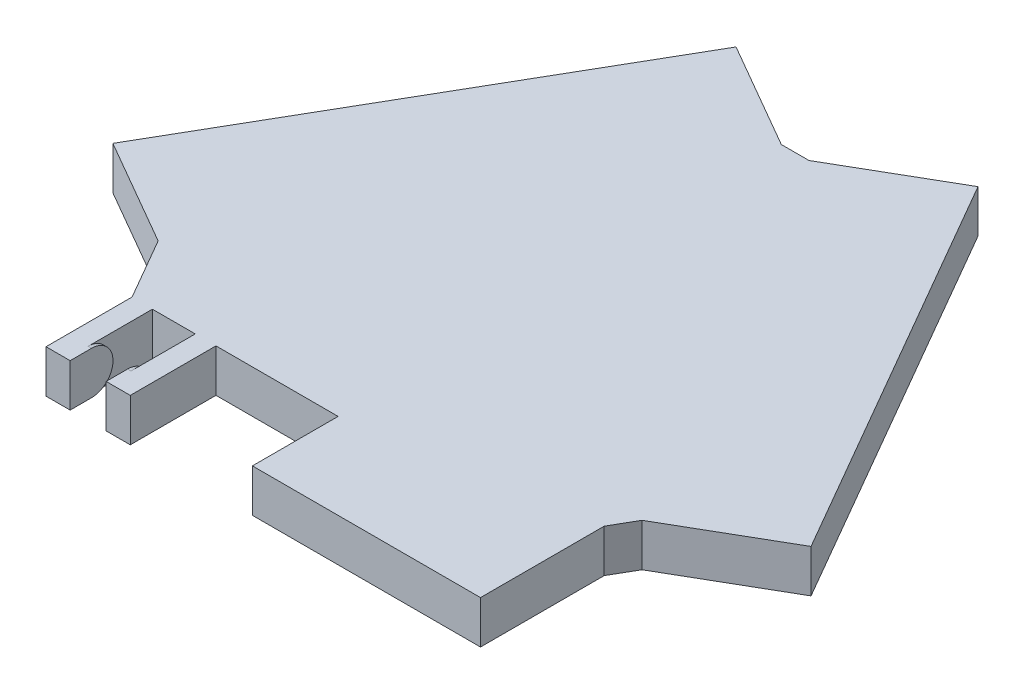
from build123d import *

# Parameters (mm, degrees)
BOSS_EXTRUDE1_DEPTH = 6
SKETCH2_W           = 6
SKETCH2_H           = 14.11413039
SKETCH2_W_2         = 17.1
CUT_EXTRUDE1_DEPTH  = 68.840245023
BOSS_EXTRUDE2_DEPTH = 0.48


with BuildPart() as part:
    # Sketch1 → Boss-Extrude1 (new body)
    with BuildSketch(Plane(origin=(0, 0, 0), x_dir=(1, 0, 0), z_dir=(0, 1, 0))):
        Polygon((-16.939310229, 46.660254038), (-21.939310229, 38), (-43.878620458, 0), (-48.878620458, -8.660254038), (-33.878620458, -17.320508076), (-31.939310229, -20.679491924), (-31.939310229, -38), (-21.939310229, -38), (21.939310229, -38), (31.939310229, -38), (31.939310229, -20.679491924), (33.878620458, -17.320508076), (48.878620458, -8.660254038), (43.878620458, 0), (21.939310229, 38), (16.939310229, 46.660254038), (1.939310229, 38), (-1.939310229, 38), align=None)
    extrude(amount=BOSS_EXTRUDE1_DEPTH)

    # Sketch2 → Cut-Extrude1 (cut, through all)
    with BuildSketch(Plane(origin=(0, 6, 0), x_dir=(1, 0, 0), z_dir=(0, 1, 0))):
        with Locations((-23, -33.057065195)):
            Rectangle(SKETCH2_W, SKETCH2_H)
        with Locations((-8.55, -33.057065195)):
            Rectangle(SKETCH2_W_2, SKETCH2_H)
        Polygon((-31.939310229, -40.11413039), (-28.9, -40.11413039), (-28.9, -25.943731661), (-31.939310229, -20.679491924), align=None)
    extrude(amount=-CUT_EXTRUDE1_DEPTH, mode=Mode.SUBTRACT)

    # Sketch16 → Boss-Extrude2 (add)
    with BuildSketch(Plane.ZY.offset(20)):
        with BuildLine():
            Line((38, 6), (38, 0))
            Line((38, 0), (35, 0))
            ThreePointArc((35, 0), (32, 3), (35, 6))
            Line((35, 6), (38, 6))
        make_face()
    boss_extrude2 = extrude(amount=BOSS_EXTRUDE2_DEPTH)

    # Mirror18: Boss-Extrude2 across plane
    add(boss_extrude2.mirror(Plane.ZY.offset(23)))


solid = part.part
